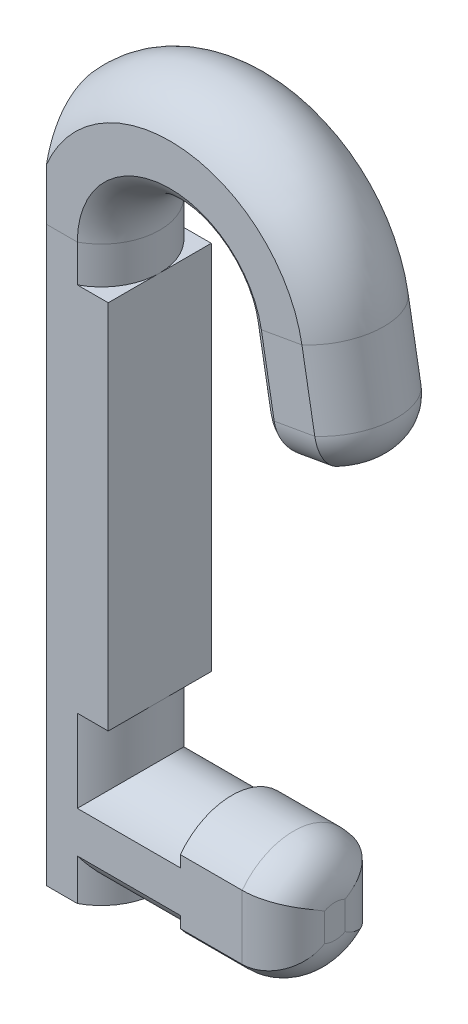
from build123d import *

# Parameters (mm, degrees)
EXTRUDE_1_DEPTH     = 5
SKETCH_19_W         = 5
SKETCH_19_H         = 18
EXTRUDE_2_DEPTH     = 1.5
FILLET_2_R          = 2
SKETCH_20_W         = 8
SKETCH_20_H         = 40
CUT_EXTRUDE_1_DEPTH = 36.961786675


with BuildPart() as part:
    # 扫描2: sweep along a path in 草图1
    with BuildLine(Plane.XY) as sweep_2_path:
        Line((11.886241035, 20.255064977), (10.916442642, 25.755064977))
        ThreePointArc((10.916442642, 25.755064977), (5.020643415, 30.27907084), (0, 24.8))
        Line((0, 24.8), (0, 0))
        Line((0, 0), (0, -3))
    # 草图13 → 扫描2 (sweep)
    with BuildSketch(Plane(origin=(0, -3, 0), x_dir=(1, 0, 0), z_dir=(0, 1, 0))):
        with BuildLine():
            Line((-1, -2.5), (1, -2.5))
            ThreePointArc((1, -2.5), (2.5, 0), (1, 2.5))
            Line((1, 2.5), (-1, 2.5))
            ThreePointArc((-1, 2.5), (-2.5, 0), (-1, -2.5))
        make_face()
    sweep(path=sweep_2_path.line)

    # 扫描4: sweep along a path in 草图15
    with BuildLine(Plane.XY) as sweep_4_path:
        Line((0, 0), (11, 0))
    # 草图16 → 扫描4 (sweep)
    with BuildSketch(Plane(origin=(11, 0, 0), x_dir=(0, 0, -1), z_dir=(1, 0, 0))):
        with BuildLine():
            Line((-2.5, -1), (-2.5, 1))
            ThreePointArc((-2.5, 1), (0, 2.5), (2.5, 1))
            Line((2.5, 1), (2.5, -1))
            ThreePointArc((2.5, -1), (0, -2.5), (-2.5, -1))
        make_face()
    sweep(path=sweep_4_path.line)

    # 草图17 → 凸台-拉伸1 (add)
    with BuildSketch(Plane(origin=(11, 0, 0), x_dir=(0, 0, -1), z_dir=(1, 0, 0))):
        with BuildLine():
            Line((-2.5, 1.555522876), (-2.5, -1.555522876))
            ThreePointArc((-2.5, -1.555522876), (0, -2.8), (2.5, -1.555522876))
            Line((2.5, -1.555522876), (2.5, 1.555522876))
            ThreePointArc((2.5, 1.555522876), (0, 2.8), (-2.5, 1.555522876))
        make_face()
    extrude(amount=-EXTRUDE_1_DEPTH)

    # 草图19 → 凸台-拉伸2 (add)
    with BuildSketch(Plane(origin=(1, 0, 0), x_dir=(0, 0, -1), z_dir=(1, 0, 0))):
        with Locations((0, 14)):
            Rectangle(SKETCH_19_W, SKETCH_19_H)
    extrude(amount=EXTRUDE_2_DEPTH)

    # 圆角2
    # the kernel refuses this fillet: 2 mm, written as the material it takes off along each edge
    with BuildSketch(Plane(origin=(17.795087554, 21.296954043, 2.5), x_dir=(0, 0, -1), z_dir=(-0.9848077530122092, -0.17364817766692373, 0))) as fillet_2_piece_1:
        with BuildLine():
            CenterArc((FILLET_2_R, -FILLET_2_R), FILLET_2_R, 90, 90)
            Line((0, -FILLET_2_R), (0, 0))
            Line((0, 0), (FILLET_2_R, 0))
        make_face()
    extrude(amount=12, mode=Mode.SUBTRACT)
    with BuildSketch(Plane(origin=(12.214510286, 20.312947703, 0), x_dir=(0.9423506208781959, 0.16616183974819204, -0.29045748456869663), z_dir=(0.2860447827236766, 0.05043741288507259, 0.9568878981667733))) as fillet_2_piece_2:
        with BuildLine():
            CenterArc((2.833333333 - FILLET_2_R, FILLET_2_R), FILLET_2_R, 270, 90)
            Line((2.833333333 - FILLET_2_R, 0), (2.833333333, 0))
            Line((2.833333333, 0), (2.833333333, FILLET_2_R))
        make_face()
    revolve(axis=Axis((12.214510286, 20.312947703, 0), (-0.173648177666923, 0.9848077530122094, 0)), revolution_arc=326.229306127, mode=Mode.SUBTRACT)
    with BuildSketch(Plane(origin=(5.977394517, 19.213175911, -2.5), x_dir=(-0.17364817766692373, 0.9848077530122092, 0), z_dir=(0.9848077530122092, 0.17364817766692373, 0))) as fillet_2_piece_3:
        with BuildLine():
            CenterArc((FILLET_2_R, FILLET_2_R), FILLET_2_R, 180, 90)
            Line((0, FILLET_2_R), (0, 0))
            Line((0, 0), (FILLET_2_R, 0))
        make_face()
    extrude(amount=12, mode=Mode.SUBTRACT)
    with BuildSketch(Plane(origin=(11, -6.555522876, 2.5), x_dir=(0, 0, -1), z_dir=(0, 1, 0))) as fillet_2_piece_4:
        with BuildLine():
            CenterArc((FILLET_2_R, FILLET_2_R), FILLET_2_R, 180, 90)
            Line((0, FILLET_2_R), (0, 0))
            Line((0, 0), (FILLET_2_R, 0))
        make_face()
    extrude(amount=13.111045751, mode=Mode.SUBTRACT)
    with BuildSketch(Plane(origin=(11, 6.555522876, -2.5), x_dir=(-1, 0, 0), z_dir=(0, -1, 0))) as fillet_2_piece_5:
        with BuildLine():
            CenterArc((FILLET_2_R, -FILLET_2_R), FILLET_2_R, 90, 90)
            Line((0, -FILLET_2_R), (0, 0))
            Line((0, 0), (FILLET_2_R, 0))
        make_face()
    extrude(amount=13.111045751, mode=Mode.SUBTRACT)
    with BuildSketch(Plane(origin=(11, -0.333333333, 0), x_dir=(0, -0.8131785022115455, -0.582014367125922), z_dir=(0, -0.582014367125922, 0.8131785022115455))) as fillet_2_piece_6:
        with BuildLine():
            CenterArc((3.133333333 - FILLET_2_R, -FILLET_2_R), FILLET_2_R, 0, 90)
            Line((3.133333333, -FILLET_2_R), (3.133333333, 0))
            Line((3.133333333, 0), (3.133333333 - FILLET_2_R, 0))
        make_face()
    revolve(axis=Axis((11, -0.333333333, 0), (1, 0, 0)), revolution_arc=288.815304863, mode=Mode.SUBTRACT)
    with BuildSketch(Plane(origin=(11, 0.333333333, 0), x_dir=(0, 0.8131785022115376, 0.5820143671259329), z_dir=(0, 0.5820143671259329, -0.8131785022115376))) as fillet_2_piece_7:
        with BuildLine():
            CenterArc((3.133333333 - FILLET_2_R, -FILLET_2_R), FILLET_2_R, 0, 90)
            Line((3.133333333 - FILLET_2_R, 0), (3.133333333, 0))
            Line((3.133333333, 0), (3.133333333, -FILLET_2_R))
        make_face()
    revolve(axis=Axis((11, 0.333333333, 0), (1, 0, 0)), revolution_arc=288.815304863, mode=Mode.SUBTRACT)
    with BuildSketch(Plane(origin=(11.557971784, 20.197182251, 0), x_dir=(-0.9423506208781961, -0.16616183974819207, 0.2904574845686964), z_dir=(-0.2860447827236764, -0.05043741288507257, -0.9568878981667737))) as fillet_2_piece_8:
        with BuildLine():
            CenterArc((2.833333333 - FILLET_2_R, FILLET_2_R), FILLET_2_R, 270, 90)
            Line((2.833333333, FILLET_2_R), (2.833333333, 0))
            Line((2.833333333, 0), (2.833333333 - FILLET_2_R, 0))
        make_face()
    revolve(axis=Axis((11.557971784, 20.197182251, 0), (-0.17364817766692306, 0.9848077530122095, 0)), revolution_arc=326.229306127, mode=Mode.SUBTRACT)

    # 草图20 → 切除-拉伸1 (cut, through all)
    with BuildSketch(Plane(origin=(-0.5, 0, 0), x_dir=(0, 0, -1), z_dir=(1, 0, 0))):
        with Locations((0, 16)):
            Rectangle(SKETCH_20_W, SKETCH_20_H)
    extrude(amount=-CUT_EXTRUDE_1_DEPTH, mode=Mode.SUBTRACT)


solid = part.part
